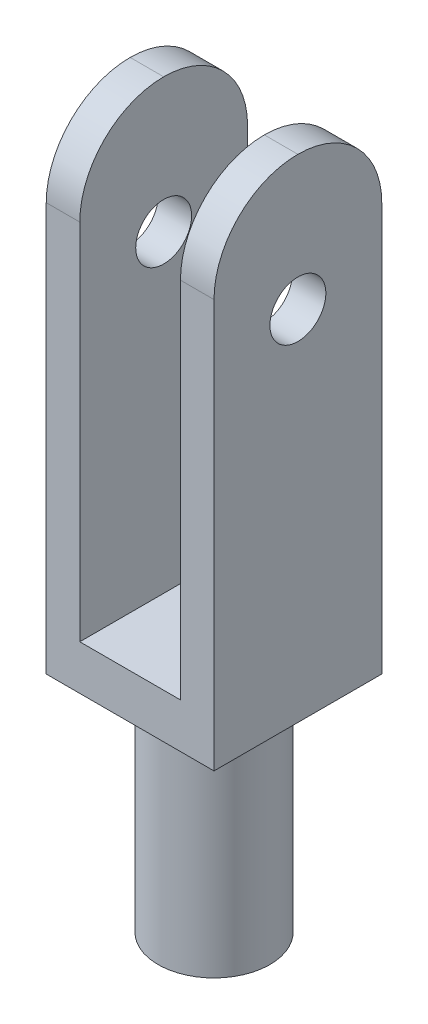
from build123d import *

# Parameters (mm, degrees)
SKETCH1_W           = 19.05
SKETCH1_H           = 19.05
BOSS_EXTRUDE1_DEPTH = 5.08
SKETCH2_W           = 3.81
SKETCH2_H           = 19.05
BOSS_EXTRUDE2_DEPTH = 50.8
FILLET1_R           = 9.525
SKETCH3_R           = 3.175
CUT_EXTRUDE1_DEPTH  = 63.035307688
SKETCH4_R           = 6.35
BOSS_EXTRUDE3_DEPTH = 25.4


with BuildPart() as part:
    # Sketch1 → Boss-Extrude1 (new body)
    with BuildSketch(Plane(origin=(0, 0, 0), x_dir=(1, 0, 0), z_dir=(0, 1, 0))):
        with Locations((9.525, -9.525)):
            Rectangle(SKETCH1_W, SKETCH1_H)
    extrude(amount=BOSS_EXTRUDE1_DEPTH)

    # Sketch2 → Boss-Extrude2 (add)
    with BuildSketch(Plane(origin=(0, 5.08, 0), x_dir=(1, 0, 0), z_dir=(0, 1, 0))):
        with Locations((1.905, -9.525)):
            Rectangle(SKETCH2_W, SKETCH2_H)
        with Locations((17.145, -9.525)):
            Rectangle(SKETCH2_W, SKETCH2_H)
    extrude(amount=BOSS_EXTRUDE2_DEPTH)

    # Fillet1
    fillet1_edges = [part.edges().sort_by_distance(p)[0] for p in [
        (1.905, 55.88, 0),
        (17.145, 55.88, 0),
        (1.905, 55.88, 19.05),
        (17.145, 55.88, 19.05),
    ]]
    fillet(fillet1_edges, radius=FILLET1_R - 0.0001)  # a hair under: the kernel refuses the full size

    # Sketch3 → Cut-Extrude1 (cut, through all)
    with BuildSketch(Plane.ZY):
        with Locations((9.525, 40.64)):
            Circle(SKETCH3_R)
    extrude(amount=-CUT_EXTRUDE1_DEPTH, mode=Mode.SUBTRACT)

    # Sketch4 → Boss-Extrude3 (add)
    with BuildSketch(Plane.XZ):
        with Locations(Location((9.525, 9.525, 0), (0, 0, 270))):
            Circle(SKETCH4_R)
    extrude(amount=BOSS_EXTRUDE3_DEPTH)


solid = part.part
